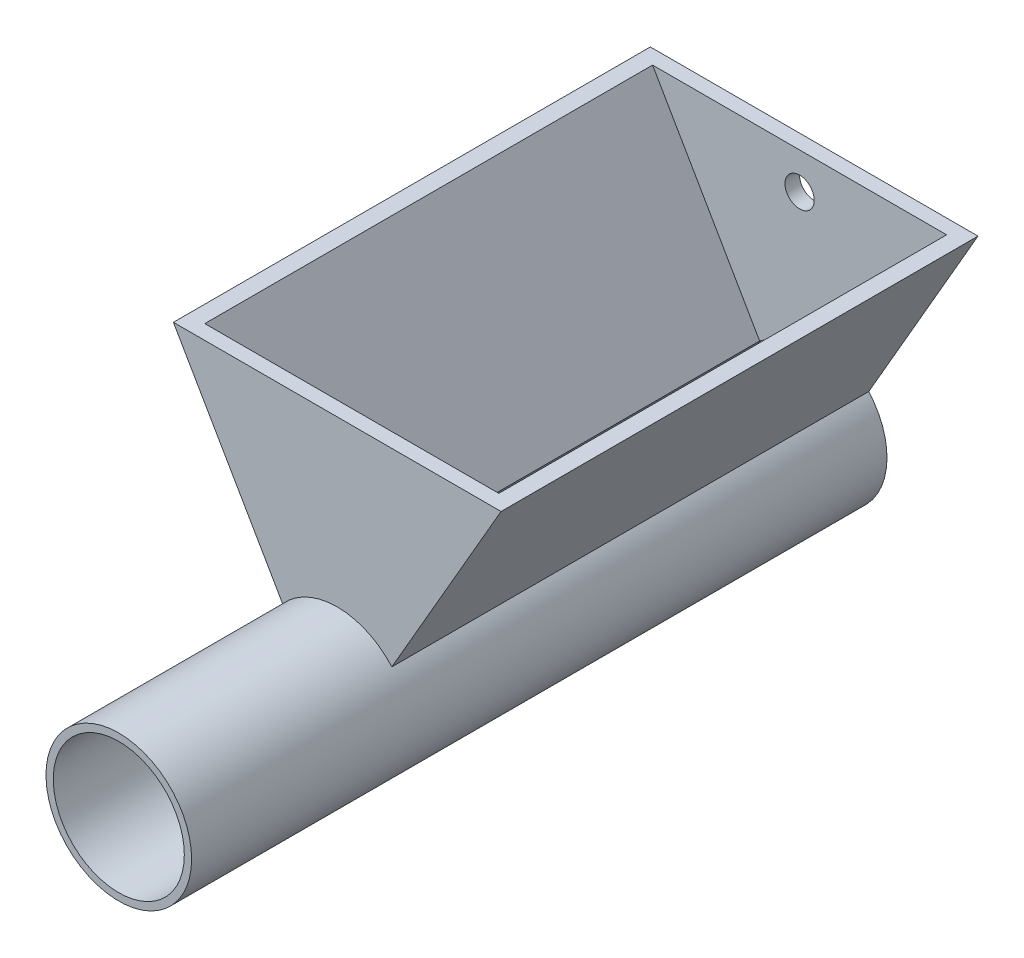
from build123d import *

# Parameters (mm, degrees)
BOSS_EXTRUDE1_DEPTH         = 41.5925
SHELL1_START                = -39.0525
SHELL1_DEPTH                = 78.105
BOSS_EXTRUDE2_START         = 38.1
SKETCH3_R                   = 12.7
BOSS_EXTRUDE2_DEPTH         = 38.1
SKETCH4_R                   = 11.43
CUT_EXTRUDE1_DEPTH          = 132.301928586
F_1_4_20_TAPPED_HOLE1_D     = 5.1054
F_1_4_20_TAPPED_HOLE1_DEPTH = 2.54


# Read off the part's stored shape, not the designer's step: Shell1
with BuildPart() as part:
    # Sketch2 → Boss-Extrude1 (new, symmetric)
    with BuildSketch(Plane.XY):
        with BuildLine():
            Line((9.525, 8.400260413), (28.575, 41.395828297))
            Line((28.575, 41.395828297), (-28.575, 41.395828297))
            Line((-28.575, 41.395828297), (-9.525, 8.400260413))
            ThreePointArc((-9.525, 8.400260413), (0, -12.7), (9.525, 8.400260413))
        make_face()
    extrude(amount=BOSS_EXTRUDE1_DEPTH, both=True)

    # Shell1 outline → Shell1 (cut)
    with BuildSketch(Plane.XY.offset(SHELL1_START)):
        with BuildLine():
            ThreePointArc((-6.330300915, 7.946879282), (0, -10.16), (6.330300915, 7.946879282))
            Line((6.330300915, 7.946879282), (25.642060633, 41.395828297))
            Line((25.642060633, 41.395828297), (-25.642060633, 41.395828297))
            Line((-25.642060633, 41.395828297), (-6.330300915, 7.946879282))
        make_face()
    extrude(amount=SHELL1_DEPTH, mode=Mode.SUBTRACT)

    # Sketch3 → Boss-Extrude2 (add)
    with BuildSketch(Plane.XY.offset(41.5925).offset(BOSS_EXTRUDE2_START)):
        with Locations(Location((0, 0, 0), (0, 0, 138.590377891))):
            Circle(SKETCH3_R)
    extrude(amount=-BOSS_EXTRUDE2_DEPTH)

    # Sketch4 → Cut-Extrude1 (cut, through all)
    with BuildSketch(Plane.XY.offset(79.6925)):
        Circle(SKETCH4_R)
    extrude(amount=-CUT_EXTRUDE1_DEPTH, mode=Mode.SUBTRACT)

    # 1/4-20 Tapped Hole1
    with Locations(Plane(origin=(0, 0, -41.5925), x_dir=(1, 0, 0), z_dir=(0, 0, -1))):
        with Locations((0, -35.045828297)):
            Hole(F_1_4_20_TAPPED_HOLE1_D / 2, depth=F_1_4_20_TAPPED_HOLE1_DEPTH)


solid = part.part
